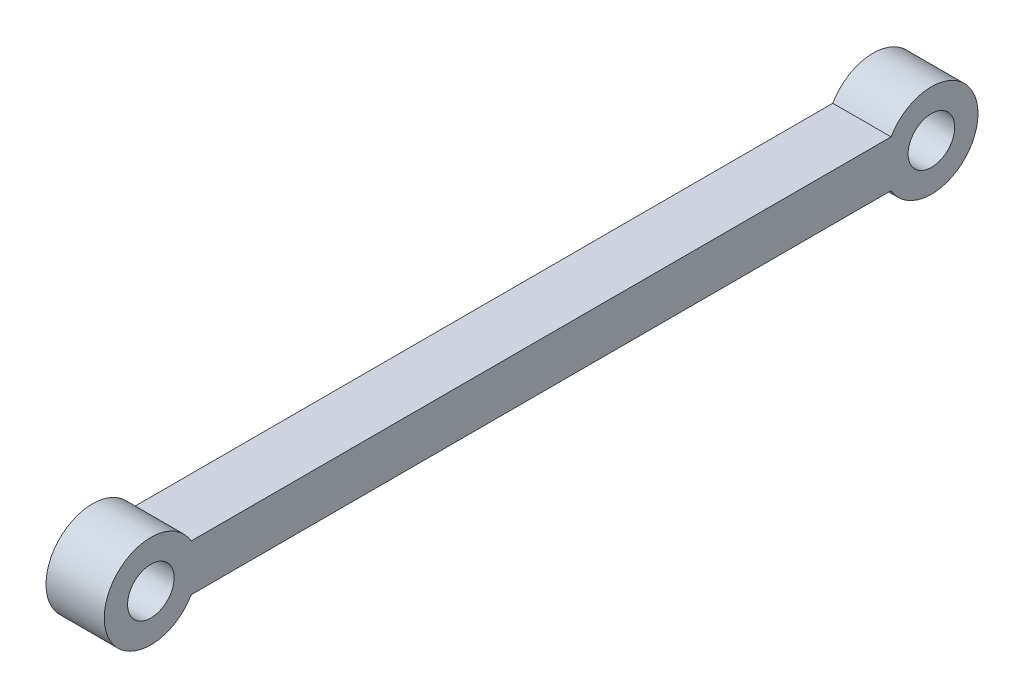
from build123d import *

# Parameters (mm, degrees)
SKETCH1_R           = 1
BOSS_EXTRUDE1_DEPTH = 1.25


with BuildPart() as part:
    # Sketch1 → Boss-Extrude1 (new, symmetric)
    with BuildSketch(Plane(origin=(0, 0, 0), x_dir=(0, 0, -1), z_dir=(1, 0, 0))):
        with BuildLine():
            Line((-15.017949192, -2), (15.017949192, -2))
            ThreePointArc((15.017949192, -2), (18.75, -1), (15.017949192, 0))
            Line((15.017949192, 0), (-15.017949192, 0))
            ThreePointArc((-15.017949192, 0), (-18.75, -1), (-15.017949192, -2))
        make_face()
        with Locations((-16.75, -1)):
            Circle(SKETCH1_R, mode=Mode.SUBTRACT)
        with Locations((16.75, -1)):
            Circle(SKETCH1_R, mode=Mode.SUBTRACT)
    extrude(amount=BOSS_EXTRUDE1_DEPTH, both=True)


solid = part.part
